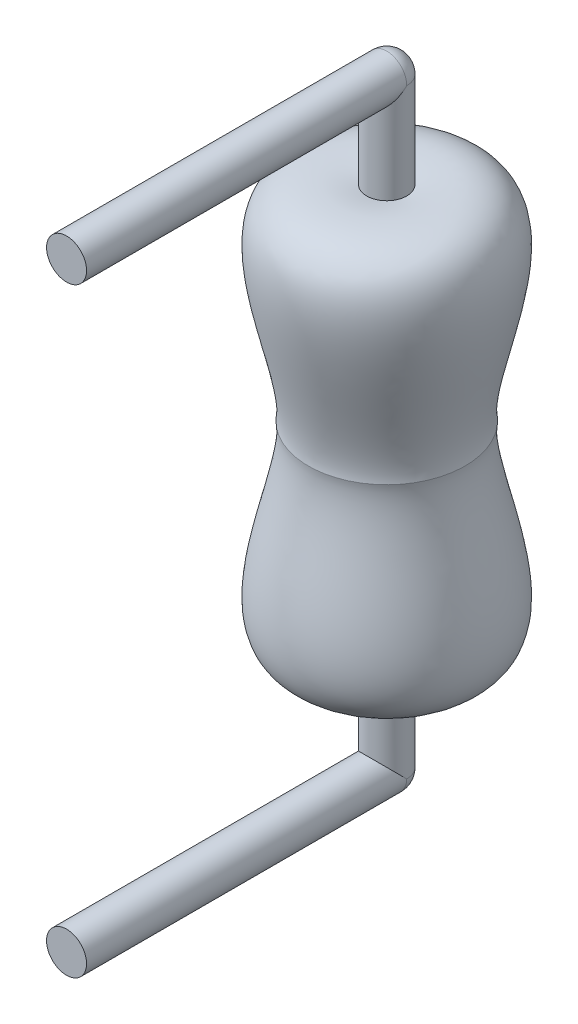
from build123d import *


with BuildPart() as part:
    # Esquisse2 → Révolution1 (revolve)
    with BuildSketch(Plane.XY):
        with BuildLine():
            add(Edge.make_bspline(
                [(-0.25, 5.05698061), (-2.107045179, 5.402904177), (-0.86139121, 3.236013516), (-0.979154643, 2.5)],
                knots=[0.040200469, 0.040200469, 0.040200469, 0.040200469, 1, 1, 1, 1], degree=3))
            add(Edge.make_bspline(
                [(-0.25, -0.05698061), (-2.107045179, -0.402904177), (-0.86139121, 1.763986484), (-0.979154643, 2.5)],
                knots=[0.040200469, 0.040200469, 0.040200469, 0.040200469, 1, 1, 1, 1], degree=3))
            Line((-0.25, -0.05698061), (-0.25, -1.25))
            Line((-0.25, -1.25), (0, -1.25))
            Line((0, -1.25), (0, 6.25))
            Line((0, 6.25), (-0.25, 6.25))
            Line((-0.25, 6.25), (-0.25, 5.05698061))
        make_face()
    revolve(axis=Axis((0, 0, 0), (0, 1, 0)))

    # Esquisse4 → Révolution2 (revolve)
    with BuildSketch(Plane(origin=(0, -1.25, 0), x_dir=(-1, 0, 0), z_dir=(0, -1, 0))):
        with BuildLine():
            ThreePointArc((0, 0.25), (-0.176776695, 0.176776695), (-0.25, 0))
            Line((-0.25, 0), (-0.25, -4))
            Line((-0.25, -4), (0, -4))
            Line((0, -4), (0, 0.25))
        make_face()
    revolve(axis=Axis((0, -1.25, 0), (0, 0, 1)))

    # Esquisse5 → Révolution3 (revolve)
    with BuildSketch(Plane(origin=(0, 6.25, 0), x_dir=(1, 0, 0), z_dir=(0, 1, 0))):
        with BuildLine():
            ThreePointArc((0, 0.25), (-0.176776695, 0.176776695), (-0.25, 0))
            Line((-0.25, 0), (-0.25, -4))
            Line((-0.25, -4), (0, -4))
            Line((0, -4), (0, 0.25))
        make_face()
    revolve(axis=Axis((0, 6.25, 0), (0, 0, 1)))


solid = part.part
